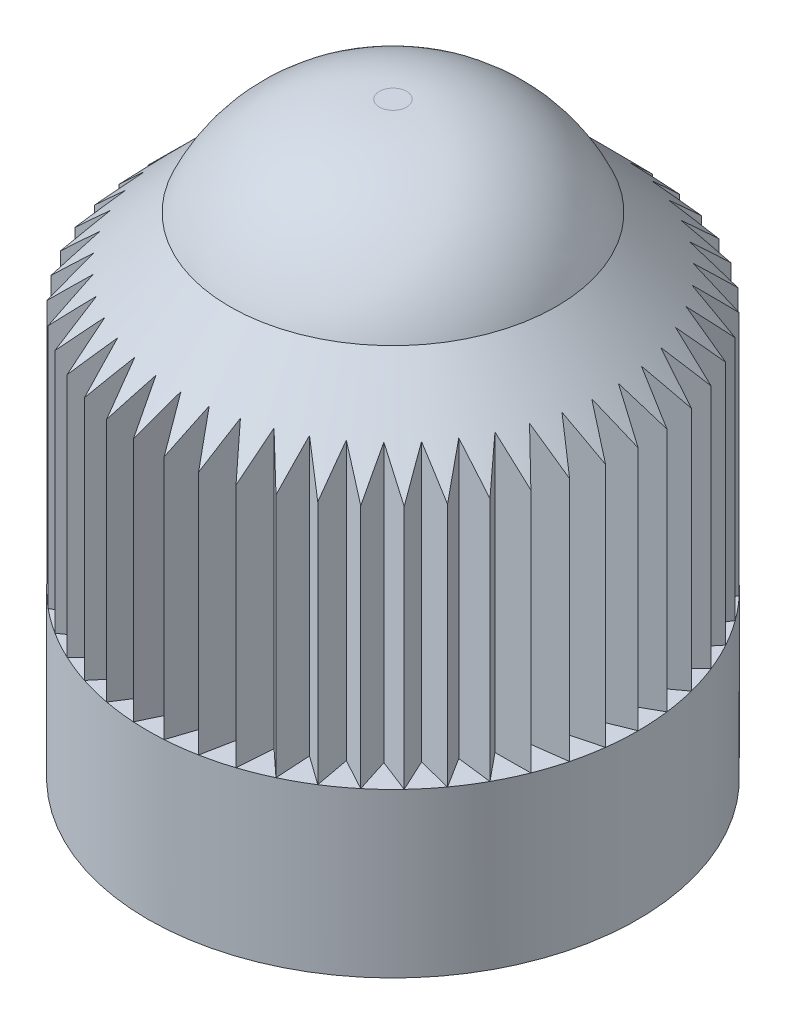
from build123d import *

# Parameters (mm, degrees)
SKETCH1_R           = 7.5
BOSS_EXTRUDE1_DEPTH = 18
SKETCH2_R           = 6.5
CUT_EXTRUDE1_DEPTH  = 3
CUT_EXTRUDE2_DEPTH  = 12
CHAMFER1_SIZE       = 1
CHAMFER1_SIZE2      = 0.577350269
SKETCH4_OUTSIDE_W   = 22.564
SKETCH4_OUTSIDE_H   = 22.564
SKETCH4_OUTSIDE_R   = 5
CUT_EXTRUDE3_DEPTH  = 13
CHAMFER2_SIZE       = 10
SKETCH5_OUTSIDE_W   = 22.564
SKETCH5_OUTSIDE_H   = 22.564
CUT_EXTRUDE4_DEPTH  = 13
FILLET1_R           = 5


with BuildPart() as part:
    # Sketch1 → Boss-Extrude1 (new body)
    with BuildSketch(Plane(origin=(0, 0, 0), x_dir=(1, 0, 0), z_dir=(0, 1, 0))):
        with Locations(Location((0, 0, 0), (0, 0, 270))):
            Circle(SKETCH1_R)
    extrude(amount=BOSS_EXTRUDE1_DEPTH)

    # Sketch2 → Cut-Extrude1 (cut)
    with BuildSketch(Plane.XZ):
        with Locations(Location((0, 0, 0), (0, 0, 270))):
            Circle(SKETCH2_R)
    extrude(amount=-CUT_EXTRUDE1_DEPTH, mode=Mode.SUBTRACT)

    # Sketch3 → Cut-Extrude2 (cut)
    with BuildSketch(Plane.XZ.offset(-3)):
        with BuildLine():
            Line((-1.742630012, -2.683885363), (3.136279729, -0.635412826))
            ThreePointArc((3.136279729, -0.635412826), (-1.238799749, 2.950487279), (-1.742630012, -2.683885363))
        make_face()
    extrude(amount=-CUT_EXTRUDE2_DEPTH, mode=Mode.SUBTRACT)

    # Chamfer1
    chamfer1_edges = [part.edges().sort_by_distance(p)[0] for p in [
        (0, 0, 6.5),
    ]]
    chamfer1_side = [part.faces().sort_by_distance(p)[0] for p in [
        (0, 1.5, 6.5),
    ]]
    chamfer(chamfer1_edges, length=CHAMFER1_SIZE, length2=CHAMFER1_SIZE2, reference=chamfer1_side[0])

    # Sketch4 outside → Cut-Extrude3 (cut)
    with BuildSketch(Plane(origin=(0, 18, 0), x_dir=(1, 0, 0), z_dir=(0, 1, 0))):
        Rectangle(SKETCH4_OUTSIDE_W, SKETCH4_OUTSIDE_H)
        with Locations(Location((0, 0, 0), (0, 0, 270))):
            Circle(SKETCH4_OUTSIDE_R, mode=Mode.SUBTRACT)
    extrude(amount=-CUT_EXTRUDE3_DEPTH, mode=Mode.SUBTRACT)

    # Chamfer2
    # the kernel refuses this chamfer: 10 mm, written as the material it adds along each edge
    with BuildSketch(Plane(origin=(0, 5, 0), x_dir=(0, 0, 1), z_dir=(-1, 0, 0))) as chamfer2_piece_1_section:
        Polygon((5 + CHAMFER2_SIZE, 0), (5, CHAMFER2_SIZE), (5, 0), align=None)
    chamfer2_piece_1 = revolve(axis=Axis((0, 5, 0), (0, 1, 0)), mode=Mode.PRIVATE)
    chamfer2_piece_1 = chamfer2_piece_1 & Plane(origin=(0, 13.822029982, 0), x_dir=(0, 0, 1), z_dir=(0, -1, 0)) * Cylinder(7.5, 60, mode=Mode.PRIVATE)
    add(chamfer2_piece_1)

    # Sketch5 outside → Cut-Extrude4 (cut)
    with BuildSketch(Plane(origin=(0, 18, 0), x_dir=(1, 0, 0), z_dir=(0, 1, 0))):
        Rectangle(SKETCH5_OUTSIDE_W, SKETCH5_OUTSIDE_H)
        Polygon((2.39855852, -6.041267833), (2.324412885, -7.130715584), (1.622473538, -6.294249727), (1.412368553, -7.365813945), (0.820801178, -6.447967542), (0.478050326, -7.48474902), (0.006184294, -6.499997058), (-0.463807041, -7.485645131), (-0.808530121, -6.449517737), (-1.398349893, -7.368488147), (-1.610493532, -6.297325669), (-2.310839933, -7.135125704), (-2.387058499, -6.045821013), (-3.186886646, -6.789238065), (-3.125978127, -5.698970148), (-4.012674253, -6.336280087), (-3.815599212, -5.26224312), (-4.77517959, -5.783395187), (-4.445046019, -4.742527374), (-5.462377492, -5.139302689), (-5.004391794, -4.148019138), (-6.063430439, -4.414160318), (-5.484815322, -3.488094163), (-6.568859465, -3.619404003), (-5.878740035, -2.773159859), (-6.970693653, -2.767567523), (-6.179953506, -2.014491167), (-7.262595838, -1.872084851), (-6.383705419, -1.224052746), (-7.439962549, -0.947078282), (-6.486782484, -0.414310283), (-7.499996605, -0.007135723), (-6.487559114, 0.401966102), (-7.441751235, 0.93291937), (-6.386023061, 1.211903241), (-7.266145003, 1.858261768), (-6.18377561, 2.002727942), (-6.975947323, 2.754298268), (-5.884006323, 2.761968426), (-6.575734787, 3.606897838), (-5.491442742, 3.477651019), (-6.071818985, 4.402614475), (-5.012275828, 4.138488978), (-5.47214697, 5.128899252), (-4.454062331, 4.734060493), (-4.786175929, 5.774298224), (-3.825605609, 5.254973047), (-4.024724034, 6.328633063), (-3.136816802, 5.693011536), (-3.199799837, 6.783161579), (-2.39855852, 6.041267833), (-2.324412885, 7.130715584), (-1.622473538, 6.294249727), (-1.412368553, 7.365813945), (-0.820801178, 6.447967542), (-0.478050326, 7.48474902), (-0.006184294, 6.499997058), (0.463807041, 7.485645131), (0.808530121, 6.449517737), (1.398349893, 7.368488147), (1.610493532, 6.297325669), (2.310839933, 7.135125704), (2.387058499, 6.045821013), (3.186886646, 6.789238065), (3.125978127, 5.698970148), (4.012674253, 6.336280087), (3.815599212, 5.26224312), (4.77517959, 5.783395187), (4.445046019, 4.742527374), (5.462377492, 5.139302689), (5.004391794, 4.148019138), (6.063430439, 4.414160318), (5.484815322, 3.488094163), (6.568859465, 3.619404003), (5.878740035, 2.773159859), (6.970693653, 2.767567523), (6.179953506, 2.014491167), (7.262595838, 1.872084851), (6.383705419, 1.224052746), (7.439962549, 0.947078282), (6.486782484, 0.414310283), (7.499996605, 0.007135723), (6.487559114, -0.401966102), (7.441751235, -0.93291937), (6.386023061, -1.211903241), (7.266145003, -1.858261768), (6.18377561, -2.002727942), (6.975947323, -2.754298268), (5.884006323, -2.761968426), (6.575734787, -3.606897838), (5.491442742, -3.477651019), (6.071818985, -4.402614475), (5.012275828, -4.138488978), (5.47214697, -5.128899252), (4.454062331, -4.734060493), (4.786175929, -5.774298224), (3.825605609, -5.254973047), (4.024724034, -6.328633063), (3.136816802, -5.693011536), (3.199799837, -6.783161579), align=None, mode=Mode.SUBTRACT)
    extrude(amount=-CUT_EXTRUDE4_DEPTH, mode=Mode.SUBTRACT)

    # Fillet1
    # the kernel refuses this fillet: 5 mm, written as the material it takes off along each edge
    with BuildSketch(Plane(origin=(0, 18, 0), x_dir=(0, 0, 1), z_dir=(-1, 0, 0))) as fillet1_piece_1:
        with BuildLine():
            CenterArc((0.417424305, -5), FILLET1_R, 23.578178478, 66.421821522)
            Line((0.417424305, 0), (0.417424305, 0.1))
            Line((0.417424305, 0.1), (5, 0.1))
            Line((5, 0.1), (5.1, 0))
            ThreePointArc((5.1, 0), (5.1, -1.5), (5.091651514, -2.96))
            Line((5.091651514, -2.96), (5, -3))
        make_face()
    revolve(axis=Axis((0, 18, 0), (0, 1, 0)), mode=Mode.SUBTRACT)


solid = part.part
